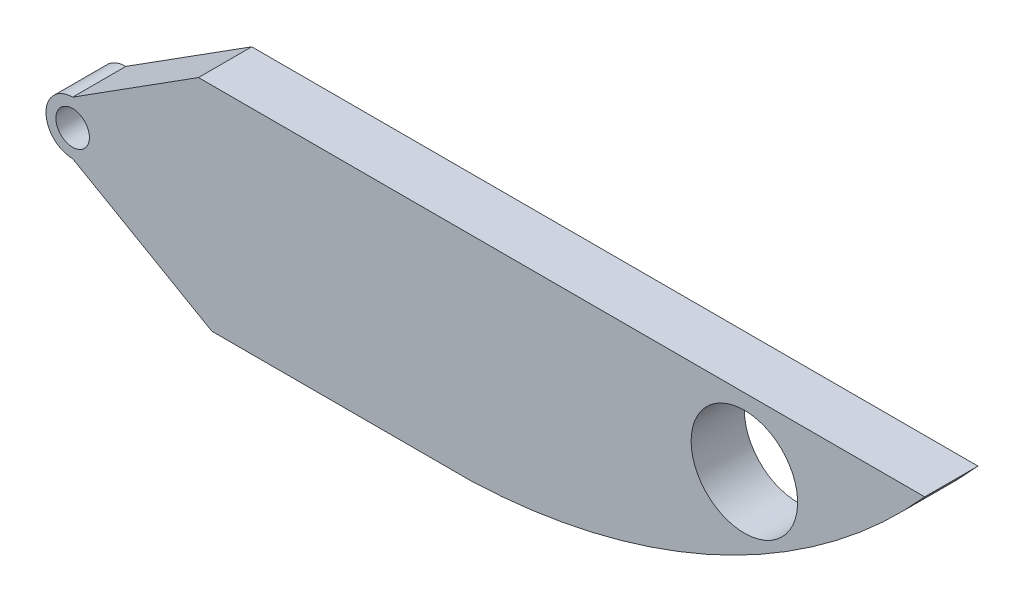
from build123d import *

# Parameters (mm, degrees)
SKETCH1_W           = 215.9
SKETCH1_H           = 50.8
BOSS_EXTRUDE1_DEPTH = 12.7
SKETCH3_R           = 4
CUT_EXTRUDE1_DEPTH  = 112.622813528
CUT_EXTRUDE2_DEPTH  = 112.622813528
SKETCH11_R          = 12.7
CUT_EXTRUDE3_DEPTH  = 112.622813528


with BuildPart() as part:
    # Sketch1 → Boss-Extrude1 (new body)
    with BuildSketch(Plane.XY):
        Rectangle(SKETCH1_W, SKETCH1_H)
    extrude(amount=BOSS_EXTRUDE1_DEPTH)

    # Sketch3 → Cut-Extrude1 (cut, through all)
    with BuildSketch(Plane.XY.offset(12.7)):
        with Locations((-95.25, 0)):
            Circle(SKETCH3_R)
    extrude(amount=-CUT_EXTRUDE1_DEPTH, mode=Mode.SUBTRACT)

    # Sketch5 → Cut-Extrude2 (cut, through all)
    with BuildSketch(Plane.XY.offset(12.7)):
        with BuildLine():
            Line((-62.046109456, -25.4), (-95.25, -6.35))
            ThreePointArc((-95.25, -6.35), (-101.6, 0), (-95.25, 6.35))
            Line((-95.25, 6.35), (-65.239311186, 25.4))
            Line((-65.239311186, 25.4), (-107.95, 25.4))
            Line((-107.95, 25.4), (-107.95, -25.4))
            Line((-107.95, -25.4), (-62.046109456, -25.4))
        make_face()
        with BuildLine():
            ThreePointArc((107.95, 25.4), (59.152628543, -11.002460654), (0, -25.4))
            Line((0, -25.4), (107.95, -25.4))
            Line((107.95, -25.4), (107.95, 25.4))
        make_face()
    extrude(amount=-CUT_EXTRUDE2_DEPTH, mode=Mode.SUBTRACT)

    # Sketch11 → Cut-Extrude3 (cut, through all)
    with BuildSketch(Plane(origin=(0, 0, 0), x_dir=(-1, 0, 0), z_dir=(0, 0, -1))):
        with Locations((-64.936259729, 9.087143278)):
            Circle(SKETCH11_R)
    extrude(amount=-CUT_EXTRUDE3_DEPTH, mode=Mode.SUBTRACT)


solid = part.part
